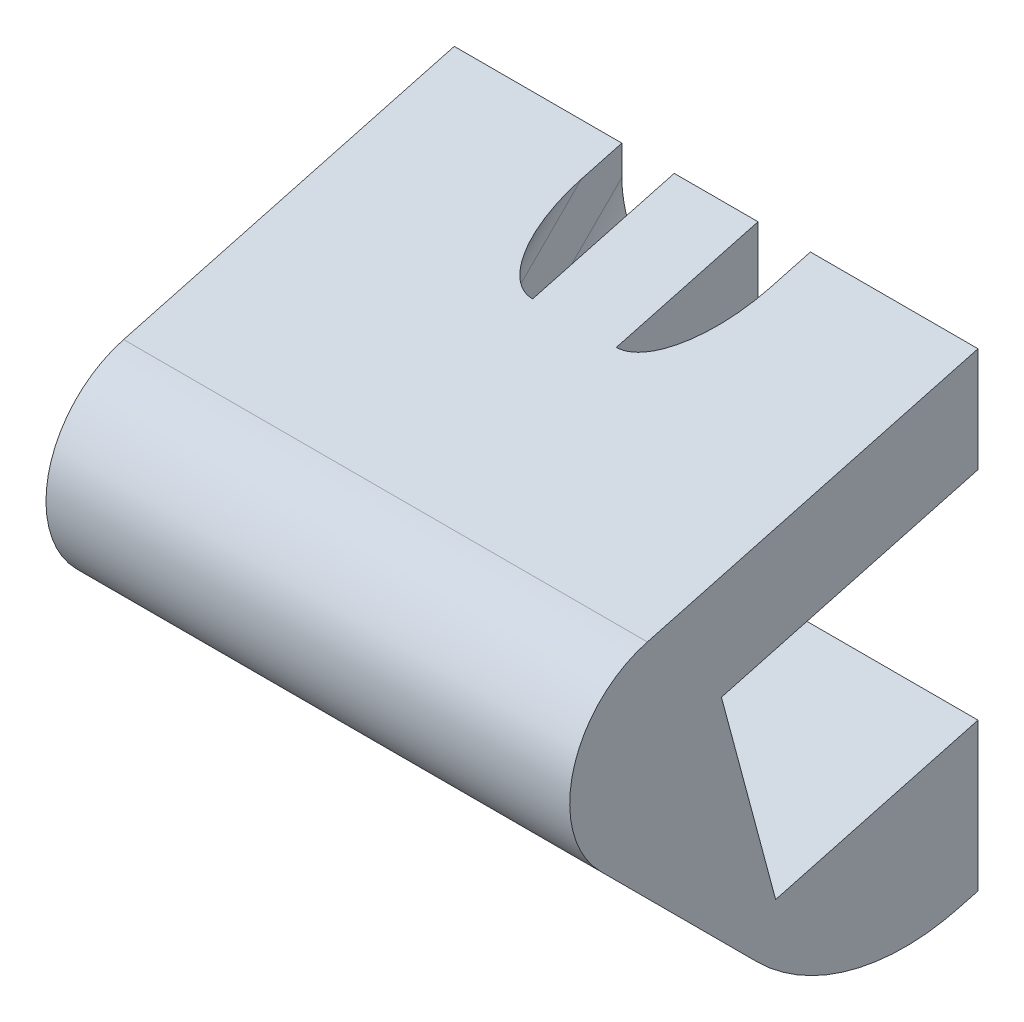
from build123d import *

# Parameters (mm, degrees)
BOSS_EXTRUDE1_START   = -3.302
BOSS_EXTRUDE1_DEPTH   = 4.572
BOSS_EXTRUDE1_START_2 = -2.032
BOSS_EXTRUDE1_2_DEPTH = 3.302
BOSS_EXTRUDE1_START_3 = -10.998522628
BOSS_EXTRUDE1_3_DEPTH = 11.998522628
BOSS_EXTRUDE1_4_DEPTH = 3.444411758
SKETCH2_W             = 2.032
SKETCH2_H             = 1.27
CUT_EXTRUDE1_DEPTH    = 3.556
BOSS_EXTRUDE2_DEPTH   = 1.27
BOSS_EXTRUDE3_DEPTH   = 4.064
BOSS_EXTRUDE4_DEPTH   = 1.27
BOSS_EXTRUDE5_START   = 1.27
BOSS_EXTRUDE5_DEPTH   = 1.27
SKETCH7_W             = 8.636
SKETCH7_H             = 3.587305501
BOSS_EXTRUDE6_DEPTH   = 4.16775137
BOSS_EXTRUDE7_START   = 4.064
BOSS_EXTRUDE7_DEPTH   = 4.064
DRAFT1_DEPTH          = 12.7
DRAFT2_START          = -7.533451599
DRAFT2_OUTLINE_W      = 12.7
DRAFT2_OUTLINE_H      = 6.098582272
DRAFT2_DEPTH          = 5.08
FILLET1_R             = 1.27
FILLET2_R             = 5.08


with BuildPart() as part:
    # Boss-Extrude1: read off the stored shape, not the designer's step
    # Boss-Extrude1 outline → Boss-Extrude1 (new body)
    with BuildSketch(Plane(origin=(7.366, 0, 0), x_dir=(0, 0, -1), z_dir=(1, 0, 0)).offset(BOSS_EXTRUDE1_START)):
        with BuildLine():
            Line((-6.519894076, -9.03436579), (-5.264597758, -7.779069472))
            Line((-5.264597758, -7.779069472), (-6.221703947, -4.207100548))
            Line((-6.221703947, -4.207100548), (0, -2.54))
            Line((0, -2.54), (0, 0))
            Line((0, 0), (-8.017755171, -2.148351023))
            ThreePointArc((-8.017755171, -2.148351023), (-9.813806395, -3.944402247), (-9.156406021, -6.397853846))
            Line((-9.156406021, -6.397853846), (-6.519894076, -9.03436579))
        make_face()
    extrude(amount=BOSS_EXTRUDE1_DEPTH)

    # Boss-Extrude1 2 outline → Boss-Extrude1 2 (add)
    with BuildSketch(Plane(origin=(7.366, 0, 0), x_dir=(0, 0, -1), z_dir=(1, 0, 0)).offset(BOSS_EXTRUDE1_START_2)):
        Polygon((-4.16775137, -11.386508497), (-4.16775137, -7.799202996), (-5.259202996, -7.799202996), (-5.264597758, -7.779069472), (-6.519894076, -9.03436579), align=None)
    extrude(amount=BOSS_EXTRUDE1_2_DEPTH)

    # Boss-Extrude1 3 outline → Boss-Extrude1 3 (cut)
    with BuildSketch(Plane(origin=(0, 0, 0), x_dir=(1, 0, 0), z_dir=(0, 0.707106781186548, -0.707106781186547)).offset(BOSS_EXTRUDE1_START_3)):
        with BuildLine():
            Line((7.366, 1.778), (7.366, -6))
            Line((7.366, -6), (8.636000001, -6))
            Line((8.636000001, -6), (8.636000002, -4.490590949))
            Line((8.636000002, -4.490590949), (8.636, 0.508))
            ThreePointArc((8.636, 0.508), (8.264025612, 1.406025612), (7.366, 1.778))
        make_face()
        with BuildLine():
            Line((4.063999999, -6), (5.334, -6))
            Line((5.334, -6), (5.334, 1.778))
            ThreePointArc((5.334, 1.778), (4.435974388, 1.406025612), (4.064, 0.508))
            Line((4.064, 0.508), (4.064, -4.490590949))
            Line((4.064, -4.490590949), (4.063999999, -6))
        make_face()
    extrude(amount=BOSS_EXTRUDE1_3_DEPTH, mode=Mode.SUBTRACT)

    # Boss-Extrude1 4 outline → Boss-Extrude1 4 (cut)
    with BuildSketch(Plane(origin=(0, 0, 0), x_dir=(1, 0, 0), z_dir=(0, 0.707106781186548, -0.707106781186547)).offset(BOSS_EXTRUDE1_START_3)):
        with BuildLine():
            Line((8.636, 1.778), (7.366, 1.778))
            ThreePointArc((7.366, 1.778), (8.264025612, 1.406025612), (8.636, 0.508))
            Line((8.636, 0.508), (8.636, 1.778))
        make_face()
        with BuildLine():
            ThreePointArc((4.064, 0.508), (4.435974388, 1.406025612), (5.334, 1.778))
            Line((5.334, 1.778), (4.064, 1.778))
            Line((4.064, 1.778), (4.064, 0.508))
        make_face()
    extrude(amount=BOSS_EXTRUDE1_4_DEPTH, mode=Mode.SUBTRACT)

    # Sketch2 → Cut-Extrude1 (cut)
    with BuildSketch(Plane(origin=(0, -1.257235857, -1.257235857), x_dir=(1, 0, 0), z_dir=(0, -0.707106781186547, -0.707106781186548))):
        with Locations((6.35, 10.363522628)):
            Rectangle(SKETCH2_W, SKETCH2_H)
    extrude(amount=-CUT_EXTRUDE1_DEPTH, mode=Mode.SUBTRACT)

    # Sketch3 → Boss-Extrude2 (add)
    with BuildSketch(Plane(origin=(7.366, 0, 0), x_dir=(0, 0, -1), z_dir=(1, 0, 0))):
        with BuildLine():
            Line((-3.434832238, -0.920360524), (-9.03436579, -6.519894076))
            Line((-9.03436579, -6.519894076), (-9.156406021, -6.397853846))
            ThreePointArc((-9.156406021, -6.397853846), (-9.813806395, -3.944402247), (-8.017755171, -2.148351023))
            Line((-8.017755171, -2.148351023), (-3.434832238, -0.920360524))
        make_face()
    extrude(amount=BOSS_EXTRUDE2_DEPTH)

    # Sketch4 → Boss-Extrude3 (add)
    with BuildSketch(Plane(origin=(8.636, 0, 0), x_dir=(0, 0, -1), z_dir=(1, 0, 0))):
        with BuildLine():
            Line((-4.16775137, -11.386508497), (-9.156406021, -6.397853846))
            ThreePointArc((-9.156406021, -6.397853846), (-9.813806395, -3.944402247), (-8.017755171, -2.148351023))
            Line((-8.017755171, -2.148351023), (0, 0))
            Line((0, 0), (0, -2.54))
            Line((0, -2.54), (-6.221703947, -4.207100548))
            Line((-6.221703947, -4.207100548), (-5.259202996, -7.799202996))
            Line((-5.259202996, -7.799202996), (-4.16775137, -7.799202996))
            Line((-4.16775137, -7.799202996), (-4.16775137, -11.386508497))
        make_face()
    extrude(amount=BOSS_EXTRUDE3_DEPTH)

    # Sketch5 → Boss-Extrude4 (add)
    with BuildSketch(Plane.ZY.offset(-5.334)):
        Polygon((4.16775137, -11.386508497), (4.16775137, -7.799202996), (5.259202996, -7.799202996), (5.264597758, -7.779069472), (6.519894076, -9.03436579), align=None)
    extrude(amount=BOSS_EXTRUDE4_DEPTH)

    # Sketch6 → Boss-Extrude5 (add)
    with BuildSketch(Plane.ZY.offset(-5.334).offset(BOSS_EXTRUDE5_START)):
        with BuildLine():
            Line((9.156406021, -6.397853846), (9.03436579, -6.519894076))
            Line((9.03436579, -6.519894076), (3.434832238, -0.920360524))
            Line((3.434832238, -0.920360524), (8.017755171, -2.148351023))
            ThreePointArc((8.017755171, -2.148351023), (9.813806395, -3.944402247), (9.156406021, -6.397853846))
        make_face()
    extrude(amount=-BOSS_EXTRUDE5_DEPTH)

    # Sketch7 → Boss-Extrude6 (add)
    with BuildSketch(Plane(origin=(0, 0, 4.16775137), x_dir=(-1, 0, 0), z_dir=(0, 0, -1))):
        with Locations((-8.382, -9.592855747)):
            Rectangle(SKETCH7_W, SKETCH7_H)
    extrude(amount=BOSS_EXTRUDE6_DEPTH)

    # Sketch8 → Boss-Extrude7 (add)
    with BuildSketch(Plane.ZY.offset(-4.064).offset(BOSS_EXTRUDE7_START)):
        with BuildLine():
            Line((4.16775137, -11.386508497), (0, -11.386508497))
            Line((0, -11.386508497), (0, -7.799202996))
            Line((0, -7.799202996), (5.259202996, -7.799202996))
            Line((5.259202996, -7.799202996), (6.221703947, -4.207100548))
            Line((6.221703947, -4.207100548), (0, -2.54))
            Line((0, -2.54), (0, 0))
            Line((0, 0), (8.017755171, -2.148351023))
            ThreePointArc((8.017755171, -2.148351023), (9.813806395, -3.944402247), (9.156406021, -6.397853846))
            Line((9.156406021, -6.397853846), (4.16775137, -11.386508497))
        make_face()
    extrude(amount=-BOSS_EXTRUDE7_DEPTH)

    # Draft1: read off the stored shape, not the designer's step
    # Draft1 outline → Draft1 (add)
    with BuildSketch(Plane.YZ):
        Polygon((-11.386508497, 4.16775137), (-12.267257994, 3.287001873), (-11.386508497, 0), align=None)
    extrude(amount=DRAFT1_DEPTH)

    # Draft2: read off the stored shape, not the designer's step
    # Draft2 outline → Draft2 (cut)
    with BuildSketch(Plane(origin=(0, 0, 0), x_dir=(1, 0, 0), z_dir=(0, 0.9659258262890691, 0.2588190451025181)).offset(DRAFT2_START)):
        with Locations((6.35, -4.049291136)):
            Rectangle(DRAFT2_OUTLINE_W, DRAFT2_OUTLINE_H)
    extrude(amount=DRAFT2_DEPTH, mode=Mode.SUBTRACT)

    # Fillet1
    # the kernel refuses this fillet: 1.27 mm, written as the material it adds along each edge
    with BuildSketch(Plane(origin=(8.636, 1.324703506, 1.189768208), x_dir=(-1, 0, 0), z_dir=(0, -0.7071067811865481, 0.707106781186547))) as fillet1_piece_1_section:
        with BuildLine():
            CenterArc((FILLET1_R, FILLET1_R), FILLET1_R, 180, 90)
            Line((0, FILLET1_R), (0, 0))
            Line((0, 0), (FILLET1_R, 0))
        make_face()
    fillet1_piece_1 = extrude(amount=11.093936292, mode=Mode.PRIVATE)
    fillet1_piece_1 = split(fillet1_piece_1, bisect_by=Plane(origin=(8.636, -0.303841036, 7.267579181), z_dir=(0, 0.2588190451025224, -0.9659258262890679)), keep=Keep.TOP, mode=Mode.PRIVATE)
    fillet1_piece_1 = split(fillet1_piece_1, bisect_by=Plane(origin=(8.636, -0.208703743, 0.778892974), z_dir=(0, -0.9659258262890681, -0.2588190451025218)), keep=Keep.TOP, mode=Mode.PRIVATE)
    fillet1_piece_1 = split(fillet1_piece_1, bisect_by=Plane(origin=(8.636, -2.578556006, 0.143892974), z_dir=(0, 0.9659258262890685, 0.2588190451025197)), keep=Keep.TOP, mode=Mode.PRIVATE)
    add(fillet1_piece_1)
    with BuildSketch(Plane(origin=(8.636, 1.324703506, 1.189768208), x_dir=(-1, 0, 0), z_dir=(0, -0.7071067811865481, 0.707106781186547))) as fillet1_piece_2_section:
        with BuildLine():
            CenterArc((FILLET1_R, FILLET1_R), FILLET1_R, 180, 90)
            Line((0, FILLET1_R), (0, 0))
            Line((0, 0), (FILLET1_R, 0))
        make_face()
    fillet1_piece_2 = extrude(amount=11.093936292, mode=Mode.PRIVATE)
    fillet1_piece_2 = split(fillet1_piece_2, bisect_by=Plane(origin=(8.636, -0.303841036, 7.267579181), z_dir=(0, -0.2588190451025224, 0.9659258262890679)), keep=Keep.TOP, mode=Mode.PRIVATE)
    fillet1_piece_2 = split(fillet1_piece_2, bisect_by=Plane(origin=(8.636, -2.578556006, 0.143892974), z_dir=(0, 0.9659258262890685, 0.2588190451025197)), keep=Keep.TOP, mode=Mode.PRIVATE)
    add(fillet1_piece_2)
    with BuildSketch(Plane(origin=(8.636, 1.324703506, 1.189768208), x_dir=(-1, 0, 0), z_dir=(0, -0.7071067811865481, 0.707106781186547))) as fillet1_piece_3_section:
        with BuildLine():
            CenterArc((FILLET1_R, FILLET1_R), FILLET1_R, 180, 90)
            Line((0, FILLET1_R), (0, 0))
            Line((0, 0), (FILLET1_R, 0))
        make_face()
    fillet1_piece_3 = extrude(amount=11.093936292, mode=Mode.PRIVATE)
    fillet1_piece_3 = split(fillet1_piece_3, bisect_by=Plane(origin=(8.636, -0.303841036, 7.267579181), z_dir=(0, -0.2588190451025224, 0.9659258262890679)), keep=Keep.TOP, mode=Mode.PRIVATE)
    fillet1_piece_3 = split(fillet1_piece_3, bisect_by=Plane(origin=(8.636, -2.578556006, 0.143892974), z_dir=(0, -0.9659258262890685, -0.2588190451025197)), keep=Keep.TOP, mode=Mode.PRIVATE)
    add(fillet1_piece_3)
    with BuildSketch(Plane(origin=(4.064, -5.534005442, 3.019533728), x_dir=(1, 0, 0), z_dir=(0, -0.707106781186547, 0.707106781186548))) as fillet1_piece_4_section:
        with BuildLine():
            CenterArc((FILLET1_R, FILLET1_R), FILLET1_R, 180, 90)
            Line((0, FILLET1_R), (0, 0))
            Line((0, 0), (FILLET1_R, 0))
        make_face()
    fillet1_piece_4 = extrude(amount=4.950257078, mode=Mode.PRIVATE)
    fillet1_piece_4 = split(fillet1_piece_4, bisect_by=Plane(origin=(4.064, -6.245662223, 5.675472992), z_dir=(0, -0.2588190451025224, 0.9659258262890679)), keep=Keep.TOP, mode=Mode.PRIVATE)
    add(fillet1_piece_4)
    with BuildSketch(Plane(origin=(4.064, -6.519894076, 9.03436579), x_dir=(1, 0, 0), z_dir=(0, 0.7071067811865481, -0.707106781186547))) as fillet1_piece_5_section:
        with BuildLine():
            CenterArc((FILLET1_R, FILLET1_R), FILLET1_R, 180, 90)
            Line((0, FILLET1_R), (0, 0))
            Line((0, 0), (FILLET1_R, 0))
        make_face()
    fillet1_piece_5 = extrude(amount=11.093936292, mode=Mode.PRIVATE)
    fillet1_piece_5 = split(fillet1_piece_5, bisect_by=Plane(origin=(4.064, -5.065193799, 9.424151555), z_dir=(0, -0.965925826289068, -0.2588190451025222)), keep=Keep.TOP, mode=Mode.PRIVATE)
    fillet1_piece_5 = split(fillet1_piece_5, bisect_by=Plane(origin=(4.064, -5.661800826, 5.831918182), z_dir=(0, -0.2588190451025224, 0.9659258262890679)), keep=Keep.TOP, mode=Mode.PRIVATE)
    add(fillet1_piece_5)
    with BuildSketch(Plane(origin=(4.064, -6.519894076, 9.03436579), x_dir=(1, 0, 0), z_dir=(0, 0.7071067811865481, -0.707106781186547))) as fillet1_piece_6_section:
        with BuildLine():
            CenterArc((FILLET1_R, FILLET1_R), FILLET1_R, 180, 90)
            Line((0, FILLET1_R), (0, 0))
            Line((0, 0), (FILLET1_R, 0))
        make_face()
    fillet1_piece_6 = extrude(amount=11.093936292, mode=Mode.PRIVATE)
    fillet1_piece_6 = split(fillet1_piece_6, bisect_by=Plane(origin=(4.064, -5.065193799, 9.424151555), z_dir=(0, 0.965925826289068, 0.2588190451025222)), keep=Keep.TOP, mode=Mode.PRIVATE)
    fillet1_piece_6 = split(fillet1_piece_6, bisect_by=Plane(origin=(4.064, -5.661800826, 5.831918182), z_dir=(0, -0.2588190451025224, 0.9659258262890679)), keep=Keep.TOP, mode=Mode.PRIVATE)
    add(fillet1_piece_6)
    with BuildSketch(Plane(origin=(4.064, -6.519894076, 9.03436579), x_dir=(1, 0, 0), z_dir=(0, 0.7071067811865481, -0.707106781186547))) as fillet1_piece_7_section:
        with BuildLine():
            CenterArc((FILLET1_R, FILLET1_R), FILLET1_R, 180, 90)
            Line((0, FILLET1_R), (0, 0))
            Line((0, 0), (FILLET1_R, 0))
        make_face()
    fillet1_piece_7 = extrude(amount=11.093936292, mode=Mode.PRIVATE)
    fillet1_piece_7 = split(fillet1_piece_7, bisect_by=Plane(origin=(4.064, -5.065193799, 9.424151555), z_dir=(0, 0.965925826289068, 0.2588190451025222)), keep=Keep.TOP, mode=Mode.PRIVATE)
    fillet1_piece_7 = split(fillet1_piece_7, bisect_by=Plane(origin=(4.064, -5.661800826, 5.831918182), z_dir=(0, 0.2588190451025224, -0.9659258262890679)), keep=Keep.TOP, mode=Mode.PRIVATE)
    fillet1_piece_7 = split(fillet1_piece_7, bisect_by=Plane(origin=(4.064, -2.695341536, 10.059151555), z_dir=(0, -0.9659258262890681, -0.2588190451025218)), keep=Keep.TOP, mode=Mode.PRIVATE)
    add(fillet1_piece_7)
    with BuildSketch(Plane(origin=(8.636, -9.03436579, 6.519894076), x_dir=(-1, 0, 0), z_dir=(0, 0.707106781186548, -0.7071067811865471))) as fillet1_piece_8_section:
        with BuildLine():
            CenterArc((FILLET1_R, FILLET1_R), FILLET1_R, 180, 90)
            Line((0, FILLET1_R), (0, 0))
            Line((0, 0), (FILLET1_R, 0))
        make_face()
    fillet1_piece_8 = extrude(amount=4.950257078, mode=Mode.PRIVATE)
    fillet1_piece_8 = split(fillet1_piece_8, bisect_by=Plane(origin=(8.636, -8.636452802, 5.034862587), z_dir=(0, -0.2588190451025224, 0.9659258262890679)), keep=Keep.TOP, mode=Mode.PRIVATE)
    add(fillet1_piece_8)

    # Fillet2
    fillet2_edges = [part.edges().sort_by_distance(p)[0] for p in [
        (6.35, -12.267257994, 3.287001873),
    ]]
    fillet(fillet2_edges, radius=FILLET2_R)


solid = part.part
